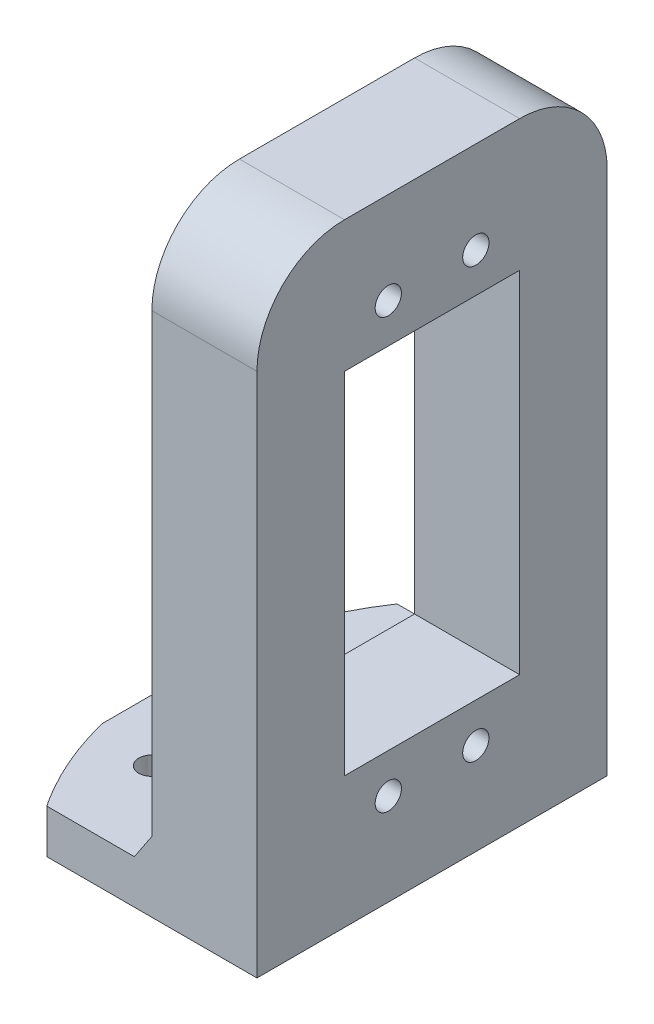
from build123d import *
from build123d.topology import SkipClean

# Parameters (mm, degrees)
SKETCH1_W           = 40
SKETCH1_H           = 70
BOSS_EXTRUDE2_DEPTH = 9
SKETCH3_W           = 20
SKETCH3_H           = 40
CUT_EXTRUDE1_DEPTH  = 42.303752856
SKETCH4_R           = 1.5
CUT_EXTRUDE2_DEPTH  = 42.303752856
SKETCH6_W           = 40
SKETCH6_H           = 5
BOSS_EXTRUDE3_DEPTH = 15
CUT_EXTRUDE3_DEPTH  = 47.914816423
BOSS_EXTRUDE4_DEPTH = 40
SKETCH9_W           = 40
SKETCH9_H           = 5
BOSS_EXTRUDE5_DEPTH = 5
SKETCH10_R          = 1.5
CUT_EXTRUDE4_DEPTH  = 71.887234394
CUT_EXTRUDE5_DEPTH  = 71.887234394
SKETCH12_R          = 1.5
SKETCH12_W          = 20
SKETCH12_H          = 40
BOSS_EXTRUDE6_DEPTH = 3
BOSS_EXTRUDE7_DEPTH = 40


with BuildPart() as part:
    # Sketch1 → Boss-Extrude2 (new body)
    with BuildSketch(Plane(origin=(0, 0, 0), x_dir=(0, 0, -1), z_dir=(1, 0, 0))):
        Rectangle(SKETCH1_W, SKETCH1_H)
    extrude(amount=BOSS_EXTRUDE2_DEPTH)

    # Sketch3 → Cut-Extrude1 (cut, through all)
    with BuildSketch(Plane.ZY):
        Rectangle(SKETCH3_W, SKETCH3_H)
    extrude(amount=-CUT_EXTRUDE1_DEPTH, mode=Mode.SUBTRACT)

    # Sketch4 → Cut-Extrude2 (cut, through all)
    with BuildSketch(Plane(origin=(9, 0, 0), x_dir=(0, 0, -1), z_dir=(1, 0, 0))):
        with Locations((-5, -24.5)):
            Circle(SKETCH4_R)
        with Locations((5, -24.5)):
            Circle(SKETCH4_R)
        with Locations((-5, 24.5)):
            Circle(SKETCH4_R)
        with Locations((5, 24.5)):
            Circle(SKETCH4_R)
    extrude(amount=-CUT_EXTRUDE2_DEPTH, mode=Mode.SUBTRACT)

    # Sketch6 → Boss-Extrude3 (add)
    with BuildSketch(Plane.ZY):
        with Locations((0, -32.5)):
            Rectangle(SKETCH6_W, SKETCH6_H)
    extrude(amount=BOSS_EXTRUDE3_DEPTH)

    # Sketch7 → Cut-Extrude3 (cut, through all)
    with BuildSketch(Plane(origin=(9, 0, 0), x_dir=(0, 0, -1), z_dir=(1, 0, 0))):
        with BuildLine():
            Line((-20, 25), (-20, 35))
            Line((-20, 35), (-10, 35))
            ThreePointArc((-10, 35), (-17.071067812, 32.071067812), (-20, 25))
        make_face()
        with BuildLine():
            Line((10, 35), (20, 35))
            Line((20, 35), (20, 25))
            ThreePointArc((20, 25), (17.071067812, 32.071067812), (10, 35))
        make_face()
    extrude(amount=-CUT_EXTRUDE3_DEPTH, mode=Mode.SUBTRACT)

    # Sketch8 → Boss-Extrude4 (add)
    with BuildSketch(Plane(origin=(0, 0, -20), x_dir=(-1, 0, 0), z_dir=(0, 0, -1))):
        Polygon((0, -27), (5, -30), (0, -30), align=None)
    extrude(amount=-BOSS_EXTRUDE4_DEPTH)

    # Sketch9 → Boss-Extrude5 (add)
    with BuildSketch(Plane.ZY.offset(15)):
        with Locations((0, -32.5)):
            Rectangle(SKETCH9_W, SKETCH9_H)
    extrude(amount=BOSS_EXTRUDE5_DEPTH)

    # Sketch10 → Cut-Extrude4 (cut, through all)
    with BuildSketch(Plane(origin=(0, -30, 0), x_dir=(1, 0, 0), z_dir=(0, 1, 0))):
        with Locations((-13, 10)):
            Circle(SKETCH10_R)
        with Locations((-13, -10)):
            Circle(SKETCH10_R)
    extrude(amount=-CUT_EXTRUDE4_DEPTH, mode=Mode.SUBTRACT)

    # Sketch11 → Cut-Extrude5 (cut, through all)
    with BuildSketch(Plane(origin=(0, -30, 0), x_dir=(1, 0, 0), z_dir=(0, 1, 0))):
        with BuildLine():
            add(Edge.make_bspline(
                [(-15, 20), (-17.354348957, 16.495802807), (-19.021015624, 12.650080232), (-20, 8.662193644)],
                knots=[0, 0, 0, 0, 0.292090214, 0.292090214, 0.292090214, 0.292090214], degree=3))
            Line((-15, 20), (-20, 20))
            Line((-20, 20), (-20, 8.662193644))
        make_face()
        with BuildLine():
            add(Edge.make_bspline(
                [(-20, -8.658433055), (-19.021015624, -12.647055954), (-17.354348957, -16.494032059), (-15, -20)],
                knots=[0.707909786, 0.707909786, 0.707909786, 0.707909786, 1, 1, 1, 1], degree=3))
            Line((-20, -8.658433055), (-20, -20))
            Line((-20, -20), (-15, -20))
        make_face()
    extrude(amount=-CUT_EXTRUDE5_DEPTH, mode=Mode.SUBTRACT)

    # Sketch12 → Boss-Extrude6 (add)
    with SkipClean():  # the faces are left unmerged after this step: merging them gives an invalid solid
        with BuildSketch(Plane.ZY):
            with BuildLine():
                Line((10, 35), (-10, 35))
                ThreePointArc((-10, 35), (-17.071067812, 32.071067812), (-20, 25))
                Line((-20, 25), (-20, -27))
                Line((-20, -27), (20, -27))
                Line((20, -27), (20, 25))
                ThreePointArc((20, 25), (17.071067812, 32.071067812), (10, 35))
            make_face()
            with Locations((-5, -24.5)):
                Circle(SKETCH12_R, mode=Mode.SUBTRACT)
            Rectangle(SKETCH12_W, SKETCH12_H, mode=Mode.SUBTRACT)
            with Locations((5, -24.5)):
                Circle(SKETCH12_R, mode=Mode.SUBTRACT)
            with Locations((-5, 24.5)):
                Circle(SKETCH12_R, mode=Mode.SUBTRACT)
            with Locations((5, 24.5)):
                Circle(SKETCH12_R, mode=Mode.SUBTRACT)
        extrude(amount=BOSS_EXTRUDE6_DEPTH)

    # Sketch13 → Boss-Extrude7 (add)
    with SkipClean():  # the faces are left unmerged after this step: merging them gives an invalid solid
        with BuildSketch(Plane(origin=(0, 0, -20), x_dir=(-1, 0, 0), z_dir=(0, 0, -1))):
            Polygon((3, -27), (5, -30), (0, -27), align=None)
        extrude(amount=-BOSS_EXTRUDE7_DEPTH)


solid = part.part
